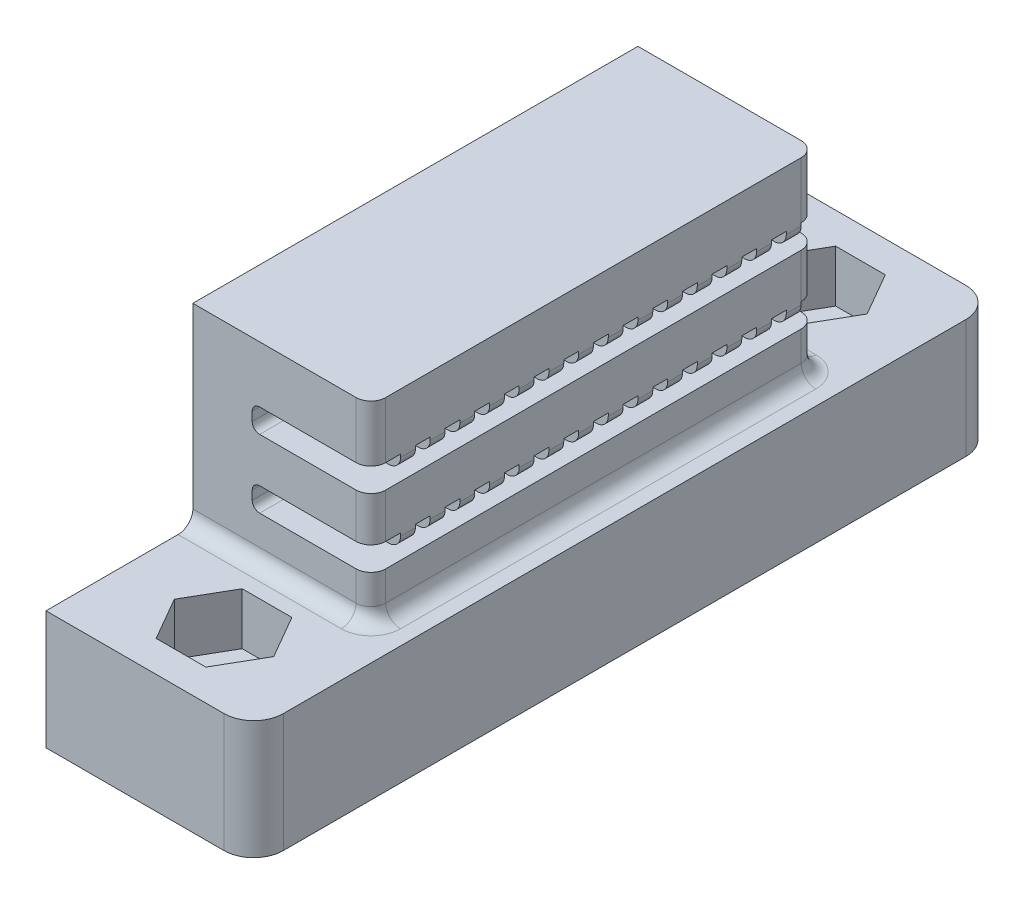
from build123d import *

# Parameters (mm, degrees)
CROQUIS1_W              = 14
CROQUIS1_H              = 50
CROQUIS1_R              = 1.55
SALIENTE_EXTRUIR1_DEPTH = 8
CORTAR_EXTRUIR1_DEPTH   = 3.5
CROQUIS3_W              = 14
CROQUIS3_H              = 30
SALIENTE_EXTRUIR3_DEPTH = 13
CORTAR_EXTRUIR2_DEPTH   = 10
CROQUIS5_W              = 30
CROQUIS5_H              = 13
CORTAR_EXTRUIR3_DEPTH   = 2
REDONDEO1_R             = 0.8
REDONDEO2_R             = 2
REDONDEO3_R             = 1
REDONDEO4_R             = 1
REDONDEO5_R             = 0.5


with BuildPart() as part:
    # Croquis1 → Saliente-Extruir1 (new body)
    with BuildSketch(Plane(origin=(0, 0, 0), x_dir=(1, 0, 0), z_dir=(0, 1, 0))):
        with Locations((7, 25)):
            Rectangle(CROQUIS1_W, CROQUIS1_H)
        with Locations((7, 45)):
            Circle(CROQUIS1_R, mode=Mode.SUBTRACT)
        with Locations((7, 5)):
            Circle(CROQUIS1_R, mode=Mode.SUBTRACT)
    extrude(amount=SALIENTE_EXTRUIR1_DEPTH)

    # Croquis2 → Cortar-Extruir1 (cut)
    with BuildSketch(Plane(origin=(0, 8, 0), x_dir=(1, 0, 0), z_dir=(0, 1, 0))):
        Polygon((10.348631561, 45), (8.674315781, 47.9), (5.325684219, 47.9), (3.651368439, 45), (5.325684219, 42.1), (8.674315781, 42.1), align=None)
        Polygon((10.348631561, 5), (8.674315781, 7.9), (5.325684219, 7.9), (3.651368439, 5), (5.325684219, 2.1), (8.674315781, 2.1), align=None)
    extrude(amount=-CORTAR_EXTRUIR1_DEPTH, mode=Mode.SUBTRACT)

    # Croquis3 → Saliente-Extruir3 (add)
    with BuildSketch(Plane(origin=(0, 8, 0), x_dir=(1, 0, 0), z_dir=(0, 1, 0))):
        with Locations((7, 24.9)):
            Rectangle(CROQUIS3_W, CROQUIS3_H)
    extrude(amount=SALIENTE_EXTRUIR3_DEPTH)

    # Croquis4 → Cortar-Extruir2 (cut)
    with BuildSketch(Plane(origin=(14, 0, 0), x_dir=(0, 0, -1), z_dir=(1, 0, 0))):
        Polygon((39.9, 17.2), (38.9, 17.2), (38.9, 16.2), (37.9, 16.2), (37.9, 17.2), (36.9, 17.2), (36.9, 16.2), (35.9, 16.2), (35.9, 17.2), (34.9, 17.2), (34.9, 16.2), (33.9, 16.2), (33.9, 17.2), (32.9, 17.2), (32.9, 16.2), (31.9, 16.2), (31.9, 17.2), (30.9, 17.2), (30.9, 16.2), (29.9, 16.2), (29.9, 17.2), (28.9, 17.2), (28.9, 16.2), (27.9, 16.2), (27.9, 17.2), (26.9, 17.2), (26.9, 16.2), (25.9, 16.2), (25.9, 17.2), (24.9, 17.2), (24.9, 16.2), (23.9, 16.2), (23.9, 17.2), (22.9, 17.2), (22.9, 16.2), (21.9, 16.2), (21.9, 17.2), (20.9, 17.2), (20.9, 16.2), (19.9, 16.2), (19.9, 17.2), (18.9, 17.2), (18.9, 16.2), (17.9, 16.2), (17.9, 17.2), (16.9, 17.2), (16.9, 16.2), (15.9, 16.2), (15.9, 17.2), (14.9, 17.2), (14.9, 16.2), (13.9, 16.2), (13.9, 17.2), (12.9, 17.2), (12.9, 16.2), (11.9, 16.2), (11.9, 17.2), (9.9, 17.2), (9.9, 15.6), (39.9, 15.6), align=None)
        Polygon((39.9, 12.6), (38.9, 12.6), (38.9, 11.6), (37.9, 11.6), (37.9, 12.6), (36.9, 12.6), (36.9, 11.6), (35.9, 11.6), (35.9, 12.6), (34.9, 12.6), (34.9, 11.6), (33.9, 11.6), (33.9, 12.6), (32.9, 12.6), (32.9, 11.6), (31.9, 11.6), (31.9, 12.6), (30.9, 12.6), (30.9, 11.6), (29.9, 11.6), (29.9, 12.6), (28.9, 12.6), (28.9, 11.6), (27.9, 11.6), (27.9, 12.6), (26.9, 12.6), (26.9, 11.6), (25.9, 11.6), (25.9, 12.6), (24.9, 12.6), (24.9, 11.6), (23.9, 11.6), (23.9, 12.6), (22.9, 12.6), (22.9, 11.6), (21.9, 11.6), (21.9, 12.6), (20.9, 12.6), (20.9, 11.6), (19.9, 11.6), (19.9, 12.6), (18.9, 12.6), (18.9, 11.6), (17.9, 11.6), (17.9, 12.6), (16.9, 12.6), (16.9, 11.6), (15.9, 11.6), (15.9, 12.6), (14.9, 12.6), (14.9, 11.6), (13.9, 11.6), (13.9, 12.6), (12.9, 12.6), (12.9, 11.6), (11.9, 11.6), (11.9, 12.6), (9.9, 12.6), (9.9, 11), (39.9, 11), align=None)
    extrude(amount=-CORTAR_EXTRUIR2_DEPTH, mode=Mode.SUBTRACT)

    # Croquis5 → Cortar-Extruir3 (cut)
    with BuildSketch(Plane(origin=(14, 0, 0), x_dir=(0, 0, -1), z_dir=(1, 0, 0))):
        with Locations((24.9, 14.5)):
            Rectangle(CROQUIS5_W, CROQUIS5_H)
    extrude(amount=-CORTAR_EXTRUIR3_DEPTH, mode=Mode.SUBTRACT)

    # Redondeo1
    redondeo1_edges = [part.edges().sort_by_distance(p)[0] for p in [
        (12, 11.6, -12.4),
        (12, 11.6, -14.4),
        (12, 11.6, -16.4),
        (12, 11.6, -18.4),
        (12, 11.6, -20.4),
        (12, 11.6, -22.4),
        (12, 11.6, -24.4),
        (12, 11.6, -26.4),
        (12, 11.6, -28.4),
        (12, 11.6, -30.4),
        (12, 11.6, -32.4),
        (12, 11.6, -34.4),
        (12, 11.6, -36.4),
        (12, 11.6, -38.4),
        (12, 16.2, -38.4),
        (12, 16.2, -36.4),
        (12, 16.2, -34.4),
        (12, 16.2, -32.4),
        (12, 16.2, -30.4),
        (12, 16.2, -28.4),
        (12, 16.2, -26.4),
        (12, 16.2, -24.4),
        (12, 16.2, -22.4),
        (12, 16.2, -20.4),
        (12, 16.2, -18.4),
        (12, 16.2, -16.4),
        (12, 16.2, -14.4),
        (12, 16.2, -12.4),
    ]]
    fillet(redondeo1_edges, radius=REDONDEO1_R)

    # Redondeo2
    redondeo2_edges = [part.edges().sort_by_distance(p)[0] for p in [
        (14, 4, -50),
        (14, 4, 0),
    ]]
    fillet(redondeo2_edges, radius=REDONDEO2_R)

    # Redondeo3
    redondeo3_edges = [part.edges().sort_by_distance(p)[0] for p in [
        (12, 19.1, -39.9),
        (12, 14.1, -39.9),
        (12, 9.5, -39.9),
        (12, 9.5, -9.9),
        (12, 14.1, -9.9),
        (12, 19.1, -9.9),
    ]]
    fillet(redondeo3_edges, radius=REDONDEO3_R)

    # Redondeo4
    redondeo4_edges = [part.edges().sort_by_distance(p)[0] for p in [
        (5.5, 8, -9.9),
        (11.707106781, 8, -10.192893219),
        (12, 8, -24.9),
        (11.707106781, 8, -39.607106781),
        (5.5, 8, -39.9),
    ]]
    fillet(redondeo4_edges, radius=REDONDEO4_R)

    # Redondeo5
    redondeo5_edges = [part.edges().sort_by_distance(p)[0] for p in [
        (4, 12.6, -10.9),
        (4, 12.6, -13.4),
        (4, 12.6, -15.4),
        (4, 12.6, -17.4),
        (4, 12.6, -19.4),
        (4, 12.6, -21.4),
        (4, 12.6, -25.4),
        (4, 12.6, -23.4),
        (4, 12.6, -27.4),
        (4, 12.6, -29.4),
        (4, 12.6, -31.4),
        (4, 12.6, -33.4),
        (4, 12.6, -35.4),
        (4, 12.6, -37.4),
        (4, 12.6, -39.4),
        (4, 17.2, -39.4),
        (4, 17.2, -37.4),
        (4, 17.2, -35.4),
        (4, 17.2, -33.4),
        (4, 17.2, -31.4),
        (4, 17.2, -29.4),
        (4, 17.2, -27.4),
        (4, 17.2, -25.4),
        (4, 17.2, -23.4),
        (4, 17.2, -21.4),
        (4, 17.2, -19.4),
        (4, 17.2, -17.4),
        (4, 17.2, -15.4),
        (4, 17.2, -13.4),
        (4, 17.2, -10.9),
        (4, 15.6, -24.9),
        (4, 11, -24.9),
    ]]
    fillet(redondeo5_edges, radius=REDONDEO5_R)


solid = part.part
